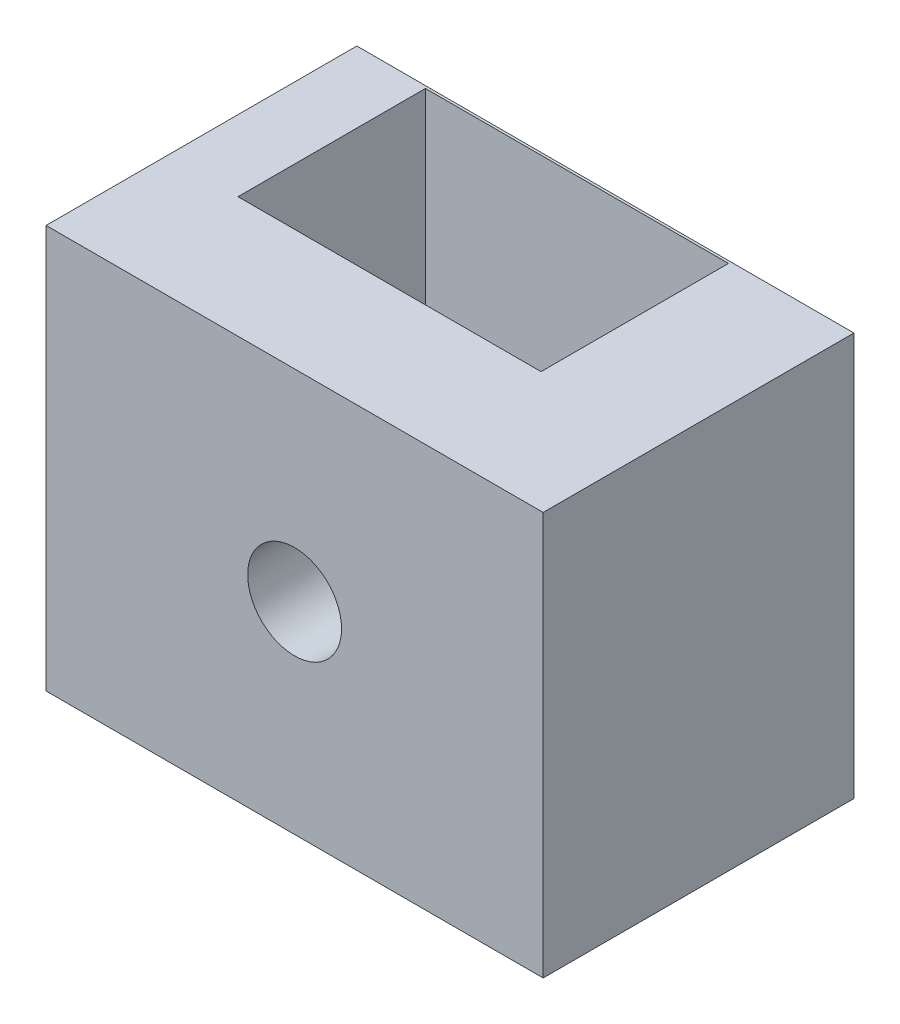
from build123d import *

# Parameters (mm, degrees)
SKETCH2_W           = 134.477697302
SKETCH2_H           = 109.076354478
BOSS_EXTRUDE1_DEPTH = 84.074
SKETCH3_R           = 12.7
CUT_EXTRUDE1_DEPTH  = 127
SKETCH4_W           = 81.978128355
SKETCH4_H           = 50.707128689
CUT_EXTRUDE2_DEPTH  = 104.14


with BuildPart() as part:
    # Sketch2 → Boss-Extrude1 (new body)
    with BuildSketch(Plane.XY):
        Rectangle(SKETCH2_W, SKETCH2_H)
    extrude(amount=BOSS_EXTRUDE1_DEPTH)

    # Sketch3 → Cut-Extrude1 (cut)
    with BuildSketch(Plane.XY.offset(84.074)):
        Circle(SKETCH3_R)
    extrude(amount=-CUT_EXTRUDE1_DEPTH, mode=Mode.SUBTRACT)

    # Sketch4 → Cut-Extrude2 (cut)
    with BuildSketch(Plane(origin=(0, 54.538177239, 0), x_dir=(1, 0, 0), z_dir=(0, 1, 0))):
        with Locations((-7.023947617, -26.021677284)):
            Rectangle(SKETCH4_W, SKETCH4_H)
    extrude(amount=-CUT_EXTRUDE2_DEPTH, mode=Mode.SUBTRACT)


solid = part.part
